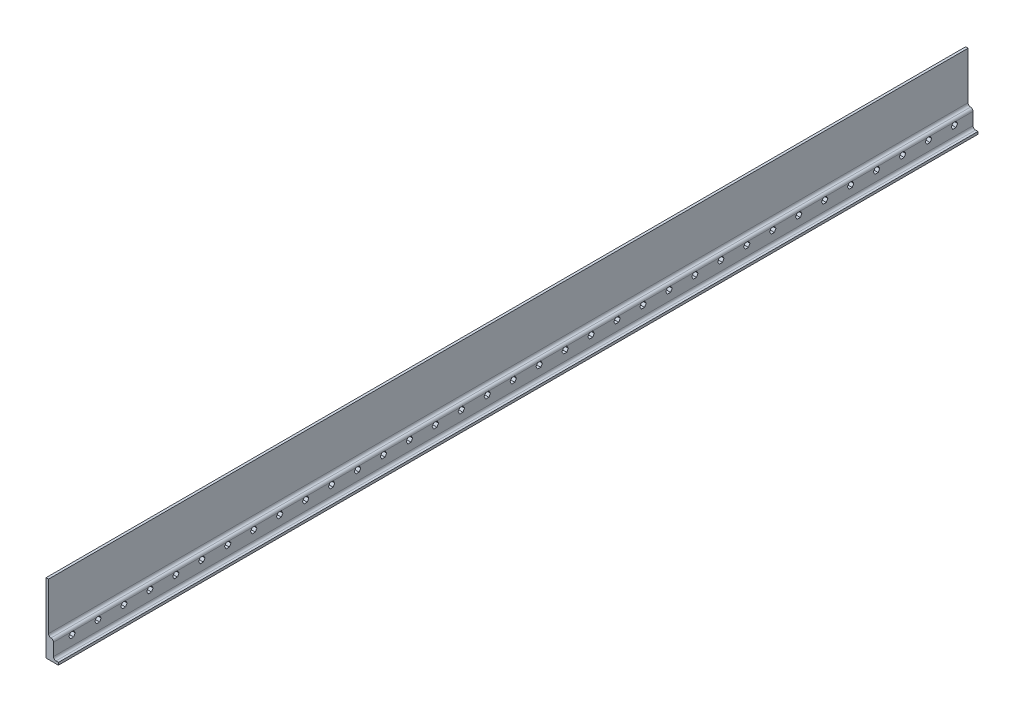
from build123d import *

# Parameters (mm, degrees)
GENERAL_EXTRUDE_DEPTH       = 925
ROUNDING_R                  = 5
ROLLER_HOLDERS_DEPTH        = 926.55388822
SKETCH5_W                   = 5
SKETCH5_H                   = 1850
GUARD_RAIL_DEPTH            = 100
GUARD_RAIL_SUPPORT_FILLET_R = 5


with BuildPart() as part:
    # Sketch2 → General extrude (new, symmetric)
    with BuildSketch(Plane.XY):
        Polygon((-12.5, 20), (-12.5, -20), (12.5, -20), (12.5, -15), (2.5, -15), (2.5, 20), align=None)
    extrude(amount=GENERAL_EXTRUDE_DEPTH, both=True)

    # Rounding
    rounding_edges = [part.edges().sort_by_distance(p)[0] for p in [
        (2.5, 20, 0),
        (2.5, -15, 0),
    ]]
    fillet(rounding_edges, radius=ROUNDING_R)

    # Sketch3 → Roller holders (cut, through all)
    with BuildSketch(Plane.ZY.offset(12.5)):
        Polygon((-884.3762927, 3.8875), (-881.168390267, 9.44375), (-884.3762927, 15), (-890.792097567, 15), (-894, 9.44375), (-890.792097567, 3.8875), align=None)
        Polygon((-832.165457693, 3.8875), (-828.957555259, 9.44375), (-832.165457693, 15), (-838.581262559, 15), (-841.789164992, 9.44375), (-838.581262559, 3.8875), align=None)
        Polygon((-779.954622685, 3.8875), (-776.746720252, 9.44375), (-779.954622685, 15), (-786.370427551, 15), (-789.578329984, 9.44375), (-786.370427551, 3.8875), align=None)
        Polygon((-727.743787677, 3.8875), (-724.535885244, 9.44375), (-727.743787677, 15), (-734.159592543, 15), (-737.367494976, 9.44375), (-734.159592543, 3.8875), align=None)
        Polygon((-675.532952669, 3.8875), (-672.325050236, 9.44375), (-675.532952669, 15), (-681.948757535, 15), (-685.156659969, 9.44375), (-681.948757535, 3.8875), align=None)
        Polygon((-623.322117661, 3.8875), (-620.114215228, 9.44375), (-623.322117661, 15), (-629.737922528, 15), (-632.945824961, 9.44375), (-629.737922528, 3.8875), align=None)
        Polygon((-571.111282653, 3.8875), (-567.90338022, 9.44375), (-571.111282653, 15), (-577.52708752, 15), (-580.734989953, 9.44375), (-577.52708752, 3.8875), align=None)
        Polygon((-518.900447645, 3.8875), (-515.692545212, 9.44375), (-518.900447645, 15), (-525.316252512, 15), (-528.524154945, 9.44375), (-525.316252512, 3.8875), align=None)
        Polygon((-466.689612638, 3.8875), (-463.481710204, 9.44375), (-466.689612638, 15), (-473.105417504, 15), (-476.313319937, 9.44375), (-473.105417504, 3.8875), align=None)
        Polygon((-414.47877763, 3.8875), (-411.270875197, 9.44375), (-414.47877763, 15), (-420.894582496, 15), (-424.102484929, 9.44375), (-420.894582496, 3.8875), align=None)
        Polygon((-362.267942622, 3.8875), (-359.060040189, 9.44375), (-362.267942622, 15), (-368.683747488, 15), (-371.891649921, 9.44375), (-368.683747488, 3.8875), align=None)
        Polygon((-310.057107614, 3.8875), (-306.849205181, 9.44375), (-310.057107614, 15), (-316.47291248, 15), (-319.680814914, 9.44375), (-316.47291248, 3.8875), align=None)
        Polygon((-257.846272606, 3.8875), (-254.638370173, 9.44375), (-257.846272606, 15), (-264.262077472, 15), (-267.469979906, 9.44375), (-264.262077472, 3.8875), align=None)
        Polygon((-205.635437598, 3.8875), (-202.427535165, 9.44375), (-205.635437598, 15), (-212.051242465, 15), (-215.259144898, 9.44375), (-212.051242465, 3.8875), align=None)
        Polygon((-153.42460259, 3.8875), (-150.216700157, 9.44375), (-153.42460259, 15), (-159.840407457, 15), (-163.04830989, 9.44375), (-159.840407457, 3.8875), align=None)
        Polygon((-101.213767583, 3.8875), (-98.005865149, 9.44375), (-101.213767583, 15), (-107.629572449, 15), (-110.837474882, 9.44375), (-107.629572449, 3.8875), align=None)
        Polygon((-49.002932575, 3.8875), (-45.795030141, 9.44375), (-49.002932575, 15), (-55.418737441, 15), (-58.626639874, 9.44375), (-55.418737441, 3.8875), align=None)
        Polygon((3.207902433, 3.8875), (6.415804866, 9.44375), (3.207902433, 15), (-3.207902433, 15), (-6.415804866, 9.44375), (-3.207902433, 3.8875), align=None)
        Polygon((55.418737441, 3.8875), (58.626639874, 9.44375), (55.418737441, 15), (49.002932575, 15), (45.795030141, 9.44375), (49.002932575, 3.8875), align=None)
        Polygon((107.629572449, 3.8875), (110.837474882, 9.44375), (107.629572449, 15), (101.213767583, 15), (98.005865149, 9.44375), (101.213767583, 3.8875), align=None)
        Polygon((159.840407457, 3.8875), (163.04830989, 9.44375), (159.840407457, 15), (153.42460259, 15), (150.216700157, 9.44375), (153.42460259, 3.8875), align=None)
        Polygon((212.051242465, 3.8875), (215.259144898, 9.44375), (212.051242465, 15), (205.635437598, 15), (202.427535165, 9.44375), (205.635437598, 3.8875), align=None)
        Polygon((264.262077472, 3.8875), (267.469979906, 9.44375), (264.262077472, 15), (257.846272606, 15), (254.638370173, 9.44375), (257.846272606, 3.8875), align=None)
        Polygon((316.47291248, 3.8875), (319.680814914, 9.44375), (316.47291248, 15), (310.057107614, 15), (306.849205181, 9.44375), (310.057107614, 3.8875), align=None)
        Polygon((368.683747488, 3.8875), (371.891649921, 9.44375), (368.683747488, 15), (362.267942622, 15), (359.060040189, 9.44375), (362.267942622, 3.8875), align=None)
        Polygon((420.894582496, 3.8875), (424.102484929, 9.44375), (420.894582496, 15), (414.47877763, 15), (411.270875197, 9.44375), (414.47877763, 3.8875), align=None)
        Polygon((473.105417504, 3.8875), (476.313319937, 9.44375), (473.105417504, 15), (466.689612638, 15), (463.481710204, 9.44375), (466.689612638, 3.8875), align=None)
        Polygon((525.316252512, 3.8875), (528.524154945, 9.44375), (525.316252512, 15), (518.900447645, 15), (515.692545212, 9.44375), (518.900447645, 3.8875), align=None)
        Polygon((577.52708752, 3.8875), (580.734989953, 9.44375), (577.52708752, 15), (571.111282653, 15), (567.90338022, 9.44375), (571.111282653, 3.8875), align=None)
        Polygon((629.737922528, 3.8875), (632.945824961, 9.44375), (629.737922528, 15), (623.322117661, 15), (620.114215228, 9.44375), (623.322117661, 3.8875), align=None)
        Polygon((681.948757535, 3.8875), (685.156659969, 9.44375), (681.948757535, 15), (675.532952669, 15), (672.325050236, 9.44375), (675.532952669, 3.8875), align=None)
        Polygon((734.159592543, 3.8875), (737.367494976, 9.44375), (734.159592543, 15), (727.743787677, 15), (724.535885244, 9.44375), (727.743787677, 3.8875), align=None)
        Polygon((786.370427551, 3.8875), (789.578329984, 9.44375), (786.370427551, 15), (779.954622685, 15), (776.746720252, 9.44375), (779.954622685, 3.8875), align=None)
        Polygon((838.581262559, 3.8875), (841.789164992, 9.44375), (838.581262559, 15), (832.165457693, 15), (828.957555259, 9.44375), (832.165457693, 3.8875), align=None)
        Polygon((890.792097567, 3.8875), (894, 9.44375), (890.792097567, 15), (884.3762927, 15), (881.168390267, 9.44375), (884.3762927, 3.8875), align=None)
    extrude(amount=-ROLLER_HOLDERS_DEPTH, mode=Mode.SUBTRACT)

    # Sketch5 → Guard rail (add)
    with BuildSketch(Plane(origin=(0, 20, 0), x_dir=(1, 0, 0), z_dir=(0, 1, 0))):
        with Locations((-10, 0)):
            Rectangle(SKETCH5_W, SKETCH5_H)
    extrude(amount=GUARD_RAIL_DEPTH)

    # Guard rail support fillet
    guard_rail_support_fillet_edges = [part.edges().sort_by_distance(p)[0] for p in [
        (-7.5, 20, 0),
    ]]
    fillet(guard_rail_support_fillet_edges, radius=GUARD_RAIL_SUPPORT_FILLET_R - 0.0001)  # a hair under: the kernel refuses the full size


solid = part.part
